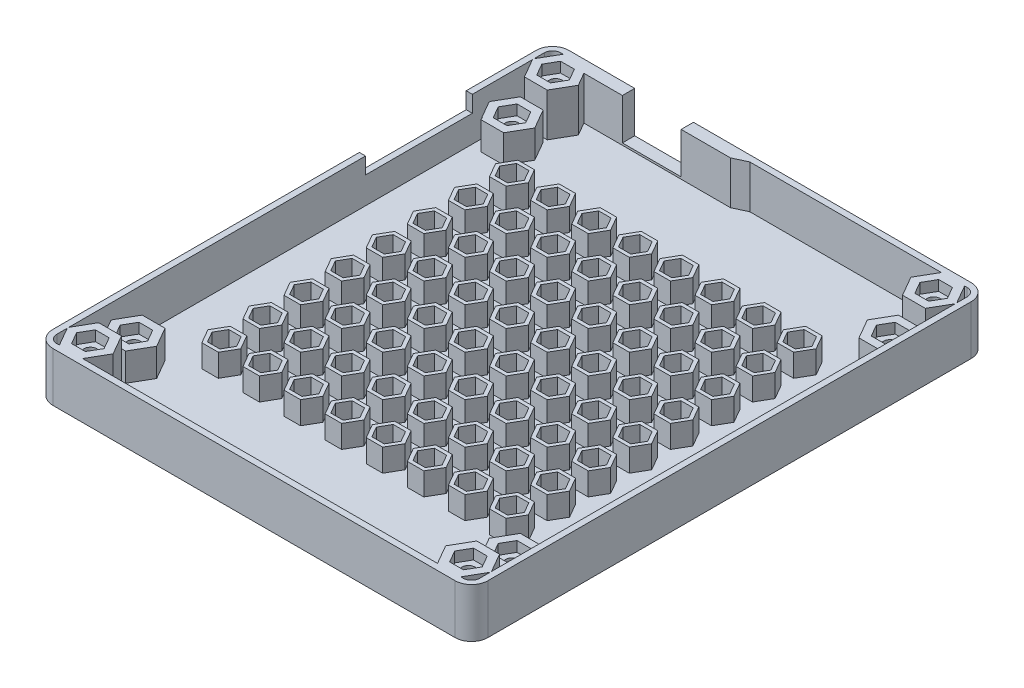
from build123d import *

# Parameters (mm, degrees)
P_IDAT_VYSUNUT_M25_DEPTH      = 3
P_IDAT_VYSUNUT_M26_DEPTH      = 10.5
P_IDAT_VYSUNUT_M26_DEPTH_BACK = 3
SKICA1_21_W                   = 105.885125168
SKICA1_21_H                   = 125.6
SKICA1_21_W_2                 = 102.885125168
SKICA1_21_H_2                 = 122.6
P_IDAT_VYSUNUT_M28_DEPTH      = 6.8
SKICA1_24_R                   = 1.6
P_IDAT_VYSUNUT_M29_DEPTH      = 4.3
LINPOLE3_COUNT                = 2
LINPOLE3_PITCH                = 92
LINPOLE3_COUNT_DIR2           = 2
LINPOLE3_PITCH_DIR2           = 92
P_IDAT_VYSUNUT_M30_DEPTH      = 10.5
SKICA1_26_R                   = 1.6
P_IDAT_VYSUNUT_M31_DEPTH      = 8
LINPOLE4_COUNT                = 2
LINPOLE4_PITCH                = 92
LINPOLE4_COUNT_DIR2           = 2
LINPOLE4_PITCH_DIR2           = 113.2
ZAOBLIT4_R                    = 4
SKICA9_W                      = 26
SKICA9_H                      = 4
ODEBRAT_VYSUNUT_M1_DEPTH      = 4
SKICA10_W                     = 14.3
SKICA10_H                     = 10
ODEBRAT_VYSUNUT_M2_DEPTH      = 5
P_IDAT_VYSUNUT_M32_DEPTH      = 5.5
LINPOLE5_COUNT                = 8
LINPOLE5_PITCH                = 10
LINPOLE5_COUNT_DIR2           = 8
LINPOLE5_PITCH_DIR2           = 10
SKICA12_W                     = 134.755212012
SKICA12_H                     = 11.049060792
ODEBRAT_VYSUNUT_M3_DEPTH      = 124.554642697
ZAOBLIT5_R                    = 2
P_IDAT_VYSUNUT_M33_DEPTH      = 1.5
P_IDAT_VYSUNUT_M34_REACH      = 85.011


with BuildPart() as part:
    # Skica1 → Přidat vysunutím25 (new body)
    with BuildSketch(Plane(origin=(0, 0, 0), x_dir=(1, 0, 0), z_dir=(0, 1, 0))):
        Polygon((51.442562584, 61.3), (-43.170983681, 61.3), (-43.228718708, 61.4), (-48.771281292, 61.4), (-48.829016319, 61.3), (-51.442562584, 61.3), (-51.442562584, 56.773205081), (-51.542562584, 56.6), (-51.442562584, 56.426794919), (-51.442562584, 46.173205081), (-51.542562584, 46), (-51.442562584, 45.826794919), (-51.442562584, -61.3), (51.442562584, -61.3), align=None)
    extrude(amount=-P_IDAT_VYSUNUT_M25_DEPTH)

    # Skica1<21> → Přidat vysunutím26 (add, two sides: drawn at the far end of the back side and taken through both)
    with BuildSketch(Plane(origin=(0, 0, 0), x_dir=(1, 0, 0), z_dir=(0, 1, 0)).offset(-P_IDAT_VYSUNUT_M26_DEPTH_BACK)):
        Rectangle(SKICA1_21_W, SKICA1_21_H)
        Rectangle(SKICA1_21_W_2, SKICA1_21_H_2, mode=Mode.SUBTRACT)
    extrude(amount=P_IDAT_VYSUNUT_M26_DEPTH + P_IDAT_VYSUNUT_M26_DEPTH_BACK)

    # Skica1<23> → Přidat vysunutím28 (add)
    with BuildSketch(Plane(origin=(0, 0, 0), x_dir=(1, 0, 0), z_dir=(0, 1, 0))):
        Polygon((-48.771281292, 41.2), (-43.228718708, 41.2), (-40.457437416, 46), (-43.228718708, 50.8), (-48.771281292, 50.8), (-51.542562584, 46), align=None)
        Polygon((-44.325684219, 43.1), (-47.674315781, 43.1), (-49.348631561, 46), (-47.674315781, 48.9), (-44.325684219, 48.9), (-42.651368439, 46), align=None, mode=Mode.SUBTRACT)
    p_idat_vysunut_m28 = extrude(amount=P_IDAT_VYSUNUT_M28_DEPTH)

    # Skica1<24> → Přidat vysunutím29 (add)
    with BuildSketch(Plane(origin=(0, 0, 0), x_dir=(1, 0, 0), z_dir=(0, 1, 0))):
        Polygon((-49.348631561, 46), (-47.674315781, 43.1), (-44.325684219, 43.1), (-42.651368439, 46), (-44.325684219, 48.9), (-47.674315781, 48.9), align=None)
        with Locations((-46, 46)):
            Circle(SKICA1_24_R, mode=Mode.SUBTRACT)
    p_idat_vysunut_m29 = extrude(amount=P_IDAT_VYSUNUT_M29_DEPTH)

    # LinPole3: Přidat vysunutím28, P_idat vysunut_m29 2 × 2
    with Locations(*[(i * LINPOLE3_PITCH, 0, j * LINPOLE3_PITCH_DIR2) for i in range(LINPOLE3_COUNT) for j in range(LINPOLE3_COUNT_DIR2) if (i, j) != (0, 0)]):
        add(p_idat_vysunut_m28)
        add(p_idat_vysunut_m29)

    # Skica1<25> → Přidat vysunutím30 (add)
    with BuildSketch(Plane(origin=(0, 0, 0), x_dir=(1, 0, 0), z_dir=(0, 1, 0))):
        Polygon((-51.542562584, 56.6), (-48.771281292, 51.8), (-43.228718708, 51.8), (-40.457437416, 56.6), (-43.228718708, 61.4), (-48.771281292, 61.4), align=None)
        Polygon((-44.325684219, 59.5), (-42.651368439, 56.6), (-44.325684219, 53.7), (-47.674315781, 53.7), (-49.348631561, 56.6), (-47.674315781, 59.5), align=None, mode=Mode.SUBTRACT)
    p_idat_vysunut_m30 = extrude(amount=P_IDAT_VYSUNUT_M30_DEPTH)

    # Skica1<26> → Přidat vysunutím31 (add)
    with BuildSketch(Plane(origin=(0, 0, 0), x_dir=(1, 0, 0), z_dir=(0, 1, 0))):
        Polygon((-44.325684219, 53.7), (-42.651368439, 56.6), (-44.325684219, 59.5), (-47.674315781, 59.5), (-49.348631561, 56.6), (-47.674315781, 53.7), align=None)
        with Locations((-46, 56.6)):
            Circle(SKICA1_26_R, mode=Mode.SUBTRACT)
    p_idat_vysunut_m31 = extrude(amount=P_IDAT_VYSUNUT_M31_DEPTH)

    # LinPole4: Přidat vysunutím30, P_idat vysunut_m31 2 × 2
    with Locations(*[(i * LINPOLE4_PITCH, 0, j * LINPOLE4_PITCH_DIR2) for i in range(LINPOLE4_COUNT) for j in range(LINPOLE4_COUNT_DIR2) if (i, j) != (0, 0)]):
        add(p_idat_vysunut_m30)
        add(p_idat_vysunut_m31)

    # Zaoblit4
    zaoblit4_edges = [part.edges().sort_by_distance(p)[0] for p in [
        (-52.942562584, 3.75, 62.8),
        (52.942562584, 3.75, 62.8),
        (52.942562584, 3.75, -62.8),
        (-52.942562584, 3.75, -62.8),
    ]]
    fillet(zaoblit4_edges, radius=ZAOBLIT4_R)

    # Skica9 → Odebrat vysunutím1 (cut)
    with BuildSketch(Plane.ZY.offset(52.942562584)):
        with Locations((-28.8, 8.5)):
            Rectangle(SKICA9_W, SKICA9_H)
    extrude(amount=-ODEBRAT_VYSUNUT_M1_DEPTH, mode=Mode.SUBTRACT)

    # Skica10 → Odebrat vysunutím2 (cut)
    with BuildSketch(Plane(origin=(0, 0, -62.8), x_dir=(-1, 0, 0), z_dir=(0, 0, -1))):
        with Locations((25.792562584, 5.5)):
            Rectangle(SKICA10_W, SKICA10_H)
    extrude(amount=-ODEBRAT_VYSUNUT_M2_DEPTH, mode=Mode.SUBTRACT)

    # Skica11 → Přidat vysunutím32 (add)
    with BuildSketch(Plane(origin=(0, 0, 0), x_dir=(1, 0, 0), z_dir=(0, 1, 0))):
        Polygon((-33, 31.535898385), (-31, 35), (-33, 38.464101615), (-37, 38.464101615), (-39, 35), (-37, 31.535898385), align=None)
        Polygon((-33.5, 32.401923789), (-32, 35), (-33.5, 37.598076211), (-36.5, 37.598076211), (-38, 35), (-36.5, 32.401923789), align=None, mode=Mode.SUBTRACT)
    p_idat_vysunut_m32 = extrude(amount=P_IDAT_VYSUNUT_M32_DEPTH)

    # LinPole5: P_idat vysunut_m32 8 × 8
    with Locations(*[(i * LINPOLE5_PITCH, 0, j * LINPOLE5_PITCH_DIR2) for i in range(LINPOLE5_COUNT) for j in range(LINPOLE5_COUNT_DIR2) if (i, j) != (0, 0)]):
        add(p_idat_vysunut_m32)

    # Skica12 → Odebrat vysunutím3 (cut, through all)
    with BuildSketch(Plane(origin=(52.942562584, 0, 0), x_dir=(0, 0, -1), z_dir=(1, 0, 0))):
        with Locations((-0.774482054, -7.024530396)):
            Rectangle(SKICA12_W, SKICA12_H)
    extrude(amount=-ODEBRAT_VYSUNUT_M3_DEPTH, mode=Mode.SUBTRACT)

    # Zaoblit5
    zaoblit5_edges = [part.edges().sort_by_distance(p)[0] for p in [
        (-51.442562584, 5.25, 61.3),
        (51.442562584, 5.25, 61.3),
        (51.442562584, 5.25, -61.3),
        (-51.442562584, 5.25, -61.3),
    ]]
    fillet(zaoblit5_edges, radius=ZAOBLIT5_R)

    # Skica13 → Přidat vysunutím33 (add)
    with BuildSketch(Plane.XY.offset(-61.3)):
        Polygon((-32.942562584, 10.5), (-43.942562584, 10.5), (-43.942562584, 0), (-6.642562584, 0), (-6.642562584, 10.5), (-18.642562584, 10.5), (-18.642562584, 0.5), (-32.942562584, 0.5), align=None)
    extrude(amount=P_IDAT_VYSUNUT_M33_DEPTH)

    # Skica14 → Přidat vysunutím34 (add, up to next)
    with BuildSketch(Plane(origin=(0, 10.5, 0), x_dir=(1, 0, 0), z_dir=(0, 1, 0)), mode=Mode.PRIVATE) as p_idat_vysunut_m34_sk1:
        Polygon((-6.642562584, 59.8), (-6.642562584, 61.3), (-3.425802203, 61.3), align=None)
    p_idat_vysunut_m34_tool1 = extrude(p_idat_vysunut_m34_sk1.sketch, amount=-P_IDAT_VYSUNUT_M34_REACH, mode=Mode.PRIVATE) - part.part
    add(p_idat_vysunut_m34_tool1.solids().sort_by_distance((-5.570309, 10.5, -60.8))[0])


solid = part.part
